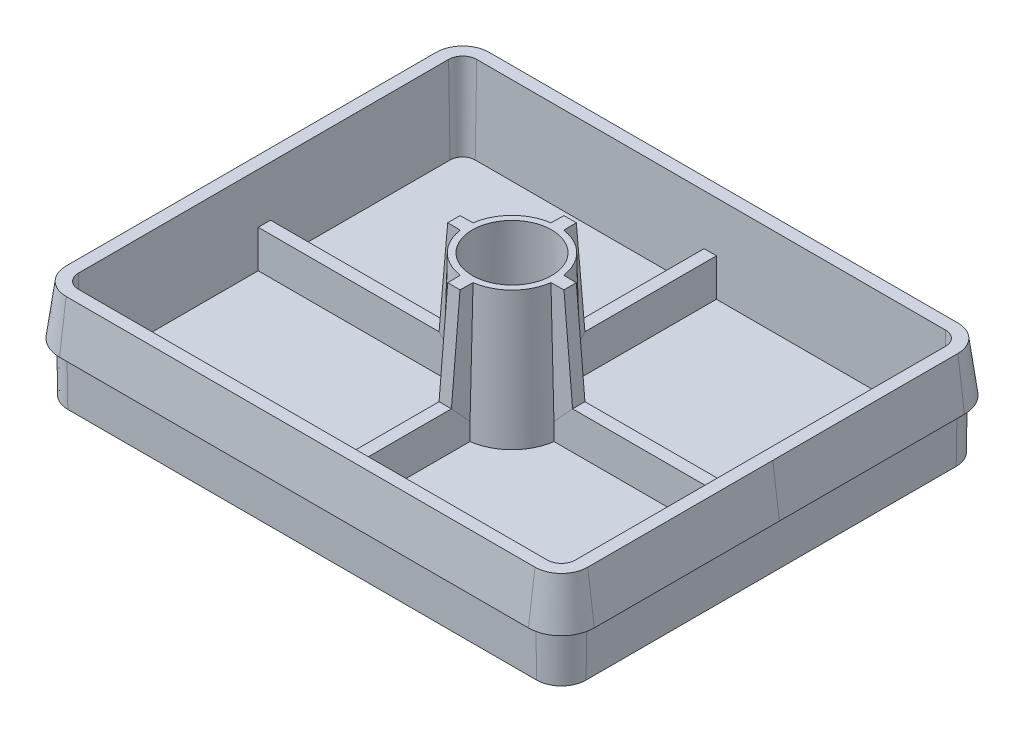
from build123d import *

# Parameters (mm, degrees)
BOSS_EXTRUDE1_DEPTH = 4
BOSS_EXTRUDE1_DRAFT = -1
SHELL1_T            = -0.5
SKETCH2_R           = 2
BOSS_EXTRUDE2_DEPTH = 5.5
BOSS_EXTRUDE2_TAPER = 1.5
CIRPATTERN1_COUNT   = 4
SKETCH4_R           = 1.605977431
CUT_EXTRUDE1_DEPTH  = 5.5
CUT_EXTRUDE1_DRAFT  = 1.5
RIB2_START          = -10.069744096
RIB2_DEPTH          = 8.231928651
RIB2_START_2        = 1.837815445
RIB2_2_DEPTH        = 8.231928651
RIB2_START_3        = -8.069744096
RIB2_3_DEPTH        = 6.231928651
RIB2_4_DEPTH        = 6.231928651


with BuildPart() as part:
    # Sketch1 → Boss-Extrude1 (with draft: the straight prism first)
    with BuildSketch(Plane(origin=(0, 0, 0), x_dir=(1, 0, 0), z_dir=(0, 1, 0))):
        with BuildLine():
            Line((-9.5, -8.5), (9.5, -8.5))
            ThreePointArc((9.5, -8.5), (10.207106781, -8.207106781), (10.5, -7.5))
            Line((10.5, -7.5), (10.5, 7.5))
            ThreePointArc((10.5, 7.5), (10.207106781, 8.207106781), (9.5, 8.5))
            Line((9.5, 8.5), (-9.5, 8.5))
            ThreePointArc((-9.5, 8.5), (-10.207106781, 8.207106781), (-10.5, 7.5))
            Line((-10.5, 7.5), (-10.5, -7.5))
            ThreePointArc((-10.5, -7.5), (-10.207106781, -8.207106781), (-9.5, -8.5))
        make_face()
    extrude(amount=BOSS_EXTRUDE1_DEPTH)
    # Boss-Extrude1: the draft: its side faces are tilted about the plane it starts from
    boss_extrude1_sides = [part.faces().sort_by_distance(p)[0] for p in [
        (0, 2, 8.5),
        (10.207106781, 2, 8.207106781),
        (10.5, 2, 0),
        (10.207106781, 2, -8.207106781),
        (0, 2, -8.5),
        (-10.207106781, 2, -8.207106781),
        (-10.5, 2, 0),
        (-10.207106781, 2, 8.207106781),
    ]]
    draft(boss_extrude1_sides, Plane(origin=(0, 0, 0), x_dir=(1, 0, 0), z_dir=(0, 1, 0)), BOSS_EXTRUDE1_DRAFT)

    # Shell1
    shell1_openings = [part.faces().sort_by_distance(p)[0] for p in [
        (0, 4, 0),
    ]]
    offset(amount=SHELL1_T, openings=shell1_openings, kind=Kind.INTERSECTION)

    # Sketch2 → Boss-Extrude2 (add)
    with BuildSketch(Plane(origin=(0, 0.5, 0), x_dir=(1, 0, 0), z_dir=(0, 1, 0))):
        Circle(SKETCH2_R)
    extrude(amount=BOSS_EXTRUDE2_DEPTH, taper=BOSS_EXTRUDE2_TAPER)

    # Rib1: read off the stored shape, not the designer's step
    # Rib1: loft between two sections, ruled curve by curve
    rib1_from = [
        Edge.make_line((1.837815545, 6, 0.259010132), (2.355977431, 6, 0.25)),
        Edge.make_line((1.837815545, 6, -0.259010132), (2.355977431, 6, -0.25)),
        Edge.make_line((2.355977431, 6, -0.25), (2.355977431, 6, 0.25)),
        Edge.make_line((1.837815545, 6, -0.259010132), (1.837815545, 6, 0.259010132)),
    ]
    rib1_to = [
        Edge.make_line((1.982384256, 0.5, 0.264863479), (2.837165081, 0.5, 0.25)),
        Edge.make_line((1.982384256, 0.5, -0.264863479), (2.837165081, 0.5, -0.25)),
        Edge.make_line((2.837165081, 0.5, -0.25), (2.837165081, 0.5, 0.25)),
        Edge.make_line((1.982384256, 0.5, -0.264863479), (1.982384256, 0.5, 0.264863479)),
    ]
    rib1 = Solid(Shell([*[Face.make_surface_from_curves(rib1_from[k], rib1_to[k]) for k in range(4)], Face(Wire(rib1_from)), Face(Wire(rib1_to))]))
    add(rib1)

    # CirPattern1: Rib1 ×4 about axis
    cirpattern1_axis = Axis((0, 0, 0), (0, 1, 0))
    for i in range(1, CIRPATTERN1_COUNT):
        add(rib1.rotate(cirpattern1_axis, i * 360 / CIRPATTERN1_COUNT))


with BuildPart() as cut_extrude1_tool:
    # Sketch4 → Cut-Extrude1 (with draft: the straight prism first)
    with BuildSketch(Plane(origin=(0, 6, 0), x_dir=(1, 0, 0), z_dir=(0, 1, 0))):
        Circle(SKETCH4_R)
    extrude(amount=-CUT_EXTRUDE1_DEPTH)
    # Cut-Extrude1: the draft: its side faces are tilted about the plane it starts from
    cut_extrude1_sides = [cut_extrude1_tool.faces().sort_by_distance(p)[0] for p in [
        (-1.605977431, 3.25, 0),
    ]]
    draft(cut_extrude1_sides, Plane(origin=(0, 6, 0), x_dir=(1, 0, 0), z_dir=(0, 1, 0)), CUT_EXTRUDE1_DRAFT)


with BuildPart() as part_1:
    add(part.part)

    # Cut-Extrude1: cut by cut_extrude1_tool
    add(cut_extrude1_tool.part, mode=Mode.SUBTRACT)

    # Sweep1: sweep along a path in Sketch6
    with BuildLine(Plane(origin=(0, 2, 0), x_dir=(-1, 0, 0), z_dir=(0, -1, 0))) as sweep1_path:
        Line((-9.5, 8.56982026), (9.5, 8.56982026))
        ThreePointArc((9.5, 8.56982026), (10.25647716, 8.25647716), (10.56982026, 7.5))
        Line((10.56982026, 7.5), (10.56982026, -7.5))
        ThreePointArc((10.56982026, -7.5), (10.25647716, -8.25647716), (9.5, -8.56982026))
        Line((9.5, -8.56982026), (-9.5, -8.56982026))
        ThreePointArc((-9.5, -8.56982026), (-10.25647716, -8.25647716), (-10.56982026, -7.5))
        Line((-10.56982026, -7.5), (-10.56982026, 7.5))
        ThreePointArc((-10.56982026, 7.5), (-10.25647716, 8.25647716), (-9.5, 8.56982026))
    # Sketch5 → Sweep1 (sweep)
    with BuildSketch(Plane.XY):
        Polygon((10.56982026, 4), (10.53491013, 2), (10.83491013, 2), align=None)
    sweep(path=sweep1_path.line)

    # Rib2: read off the stored shape, not the designer's step
    # Rib2 outline → Rib2 (add)
    with BuildSketch(Plane.YZ.offset(RIB2_START)):
        Polygon((2, 0.25), (0.5, 0.276182597), (0.5, -0.276182597), (2, -0.25), align=None)
    extrude(amount=RIB2_DEPTH)

    # Rib2 2 outline → Rib2 2 (add)
    with BuildSketch(Plane.YZ.offset(RIB2_START_2)):
        Polygon((2, 0.25), (0.5, 0.276182597), (0.5, -0.276182597), (2, -0.25), align=None)
    extrude(amount=RIB2_2_DEPTH)

    # Rib2 3 outline → Rib2 3 (add)
    with BuildSketch(Plane.XY.offset(RIB2_START_3)):
        Polygon((0.276182597, 0.5), (0.25, 2), (-0.25, 2), (-0.276182597, 0.5), align=None)
    extrude(amount=RIB2_3_DEPTH)

    # Rib2 4 outline → Rib2 4 (add)
    with BuildSketch(Plane.XY.offset(RIB2_START_2)):
        Polygon((0.276182597, 0.5), (0.25, 2), (-0.25, 2), (-0.276182597, 0.5), align=None)
    extrude(amount=RIB2_4_DEPTH)


solid = part_1.part
